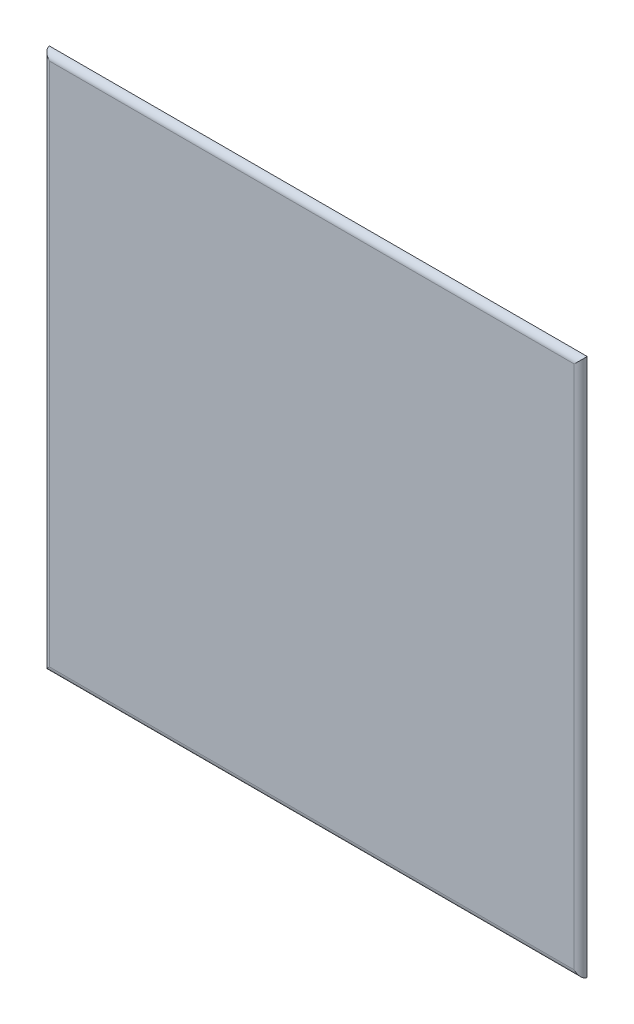
from build123d import *

# Parameters (mm, degrees)
SKETCH_1_W      = 149.5
SKETCH_1_H      = 149.5
EXTRUDE_1_DEPTH = 3
SKETCH_2_W      = 165
SKETCH_2_H      = 165
EXTRUDE_2_DEPTH = 2
FILLET_1_R      = 1
FILLET_2_R      = 2


with BuildPart() as part:
    # 草图1 → 凸台-拉伸1 (new body)
    with BuildSketch(Plane.XY):
        Rectangle(SKETCH_1_W, SKETCH_1_H)
    extrude(amount=EXTRUDE_1_DEPTH)

    # 草图2 → 凸台-拉伸2 (add)
    with BuildSketch(Plane.XY.offset(3)):
        Rectangle(SKETCH_2_W, SKETCH_2_H)
    extrude(amount=EXTRUDE_2_DEPTH)

    # 圆角1
    fillet_1_edges = [part.edges().sort_by_distance(p)[0] for p in [
        (74.75, -74.75, 1.5),
        (-74.75, -74.75, 1.5),
        (-74.75, 74.75, 1.5),
        (74.75, 74.75, 1.5),
    ]]
    fillet(fillet_1_edges, radius=FILLET_1_R)

    # 圆角2
    fillet_2_edges = [part.edges().sort_by_distance(p)[0] for p in [
        (0, -82.5, 5),
        (-82.5, 0, 5),
        (0, 82.5, 5),
        (82.5, 0, 5),
    ]]
    fillet(fillet_2_edges, radius=FILLET_2_R - 0.0001)  # a hair under: the kernel refuses the full size


solid = part.part
